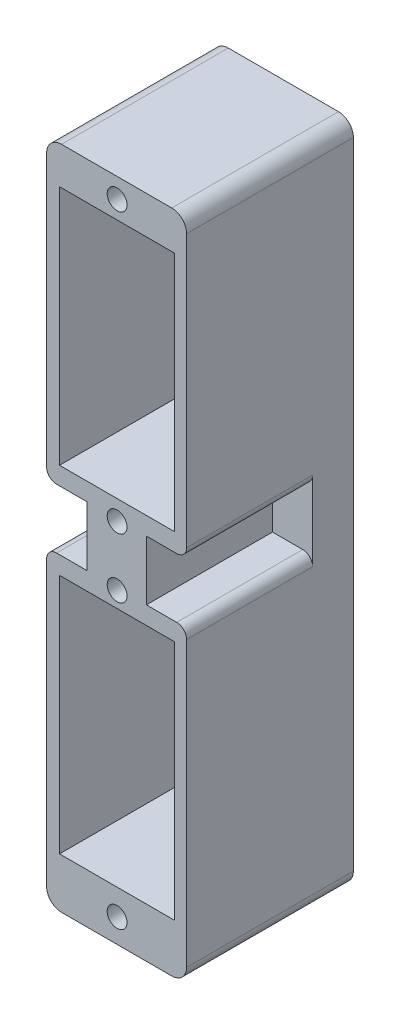
from build123d import *

# Parameters (mm, degrees)
SKETCH4_W           = 14.1
SKETCH4_H           = 67
BOSS_EXTRUDE1_DEPTH = 16.8
FILLET1_R           = 1.5
SKETCH5_W           = 11.6
SKETCH5_H           = 24.3
CUT_EXTRUDE1_DEPTH  = 16.3
SKETCH6_W           = 4.05
SKETCH6_H           = 6
CUT_EXTRUDE2_DEPTH  = 12.7
FILLET2_R           = 1
SKETCH7_R           = 1
CUT_EXTRUDE3_DEPTH  = 336.032219687


with BuildPart() as part:
    # Sketch4 → Boss-Extrude1 (new body)
    with BuildSketch(Plane.XY.offset(30)):
        with Locations((-182.786990356, 242.047210693)):
            Rectangle(SKETCH4_W, SKETCH4_H)
    extrude(amount=BOSS_EXTRUDE1_DEPTH)

    # Fillet1
    fillet1_edges = [part.edges().sort_by_distance(p)[0] for p in [
        (-189.836990356, 275.547210693, 38.4),
        (-175.736990356, 275.547210693, 38.4),
        (-189.836990356, 208.547210693, 38.4),
        (-175.736990356, 208.547210693, 38.4),
    ]]
    fillet(fillet1_edges, radius=FILLET1_R)

    # Sketch5 → Cut-Extrude1 (cut)
    with BuildSketch(Plane.XY.offset(46.8)):
        with Locations((-182.736990356, 259.597210693)):
            Rectangle(SKETCH5_W, SKETCH5_H)
        with Locations((-182.736990356, 225.697210693)):
            Rectangle(SKETCH5_W, SKETCH5_H)
    extrude(amount=-CUT_EXTRUDE1_DEPTH, mode=Mode.SUBTRACT)

    # Sketch6 → Cut-Extrude2 (cut)
    with BuildSketch(Plane.XY.offset(46.8)):
        with Locations((-187.811990356, 242.647210693)):
            Rectangle(SKETCH6_W, SKETCH6_H)
        with Locations((-177.761990356, 242.647210693)):
            Rectangle(SKETCH6_W, SKETCH6_H)
    extrude(amount=-CUT_EXTRUDE2_DEPTH, mode=Mode.SUBTRACT)

    # Fillet2
    fillet2_edges = [part.edges().sort_by_distance(p)[0] for p in [
        (-175.736990356, 239.647210693, 40.45),
        (-175.736990356, 245.647210693, 40.45),
        (-189.836990356, 239.647210693, 40.45),
        (-189.836990356, 245.647210693, 40.45),
    ]]
    fillet(fillet2_edges, radius=FILLET2_R)

    # Sketch7 → Cut-Extrude3 (cut, through all)
    with BuildSketch(Plane.XY.offset(46.8)):
        with Locations((-182.736990356, 273.547210693)):
            Circle(SKETCH7_R)
        with Locations((-182.736990356, 210.947210693)):
            Circle(SKETCH7_R)
        with Locations((-182.736990356, 245.447210693)):
            Circle(SKETCH7_R)
        with Locations((-182.736990356, 239.447210693)):
            Circle(SKETCH7_R)
    extrude(amount=-CUT_EXTRUDE3_DEPTH, mode=Mode.SUBTRACT)


solid = part.part
